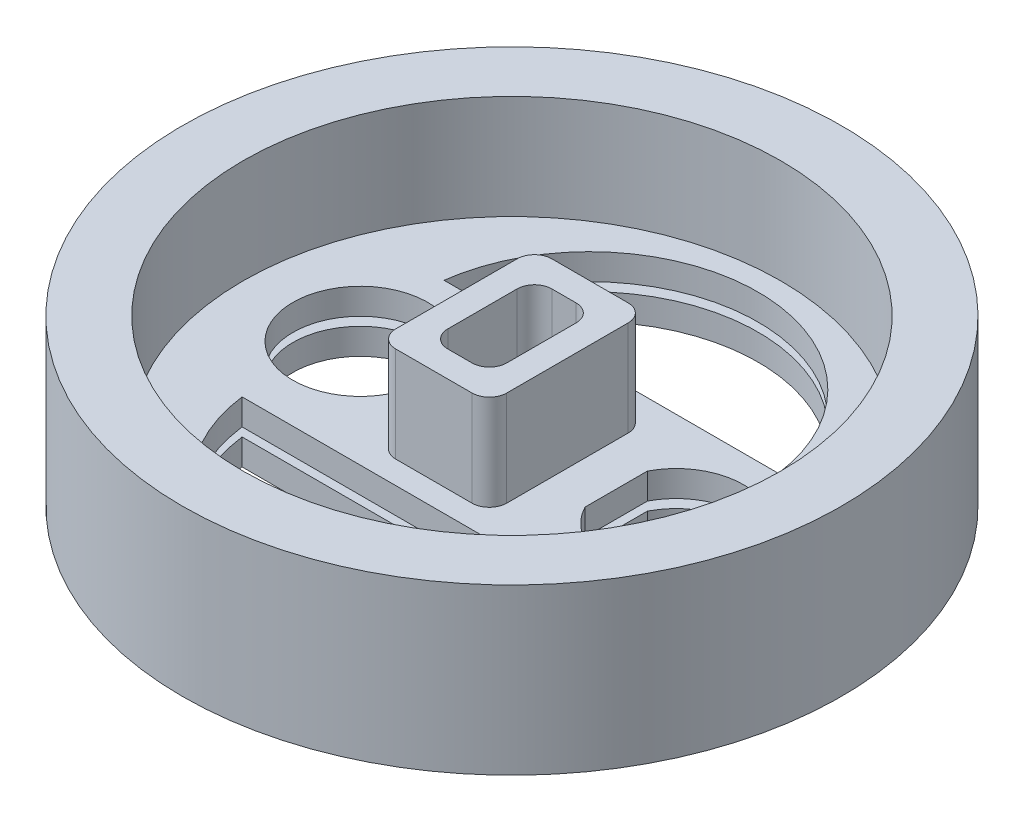
from build123d import *

# Parameters (mm, degrees)
SKETCH4_R           = 17
BOSS_EXTRUDE3_DEPTH = 6
SHELL4_T            = 0.5
SKETCH5_W           = 3.4
SKETCH5_H           = 6
BOSS_EXTRUDE4_DEPTH = 7
SHELL5_T            = 1.5
CUT_EXTRUDE2_DEPTH  = 69.741433184
FILLET1_R           = 1


with BuildPart() as part:
    # Sketch4 → Boss-Extrude3 (new body)
    with BuildSketch(Plane(origin=(0, 0, 0), x_dir=(1, 0, 0), z_dir=(0, 1, 0))):
        with Locations((0, -46.79046007)):
            Circle(SKETCH4_R)
    extrude(amount=BOSS_EXTRUDE3_DEPTH)

    # Shell4
    shell4_openings = [part.faces().sort_by_distance(p)[0] for p in [
        (0, 6, 46.79046007),
    ]]
    offset(amount=SHELL4_T, openings=shell4_openings, kind=Kind.INTERSECTION)

    # Sketch5 → Boss-Extrude4 (add)
    with BuildSketch(Plane(origin=(0, 0, 0), x_dir=(1, 0, 0), z_dir=(0, 1, 0))):
        with Locations((0, -46.79046007)):
            Rectangle(SKETCH5_W, SKETCH5_H)
    extrude(amount=BOSS_EXTRUDE4_DEPTH)

    # Shell5
    shell5_openings = [part.faces().sort_by_distance(p)[0] for p in [
        (0, 7, 46.79046007),
    ]]
    offset(amount=SHELL5_T, openings=shell5_openings, kind=Kind.INTERSECTION)

    # Sketch8 → Cut-Extrude2 (cut, through all)
    with BuildSketch(Plane(origin=(0, 1.5, 0), x_dir=(1, 0, 0), z_dir=(0, 1, 0))):
        with BuildLine():
            Line((-9.736425903, -40.96944233), (9.535773011, -40.96944233))
            ThreePointArc((9.535773011, -40.96944233), (-0.100326446, -32.500466178), (-9.736425903, -40.96944233))
        make_face()
        with BuildLine():
            Line((-9.736425903, -52.61147781), (9.535773011, -52.61147781))
            ThreePointArc((9.535773011, -52.61147781), (-0.100326446, -61.080453963), (-9.736425903, -52.61147781))
        make_face()
        with BuildLine():
            Line((-5.651322976, -44.628261801), (-5.651322976, -48.229929487))
            ThreePointArc((-5.651322976, -48.229929487), (-12.990843168, -46.429095644), (-5.651322976, -44.628261801))
        make_face()
        with BuildLine():
            Line((5.651322976, -44.628261801), (5.651322976, -48.229929487))
            ThreePointArc((5.651322976, -48.229929487), (12.990843168, -46.429095644), (5.651322976, -44.628261801))
        make_face()
    extrude(amount=-CUT_EXTRUDE2_DEPTH, mode=Mode.SUBTRACT)

    # Fillet1
    fillet1_edges = [part.edges().sort_by_distance(p)[0] for p in [
        (-1.7, 3.5, 49.79046007),
        (1.7, 3.5, 49.79046007),
        (-1.7, 3.5, 43.79046007),
        (1.7, 3.5, 43.79046007),
        (-3.2, 4.25, 42.29046007),
        (3.2, 4.25, 42.29046007),
        (3.2, 4.25, 51.29046007),
        (-3.2, 4.25, 51.29046007),
    ]]
    fillet(fillet1_edges, radius=FILLET1_R)


solid = part.part
